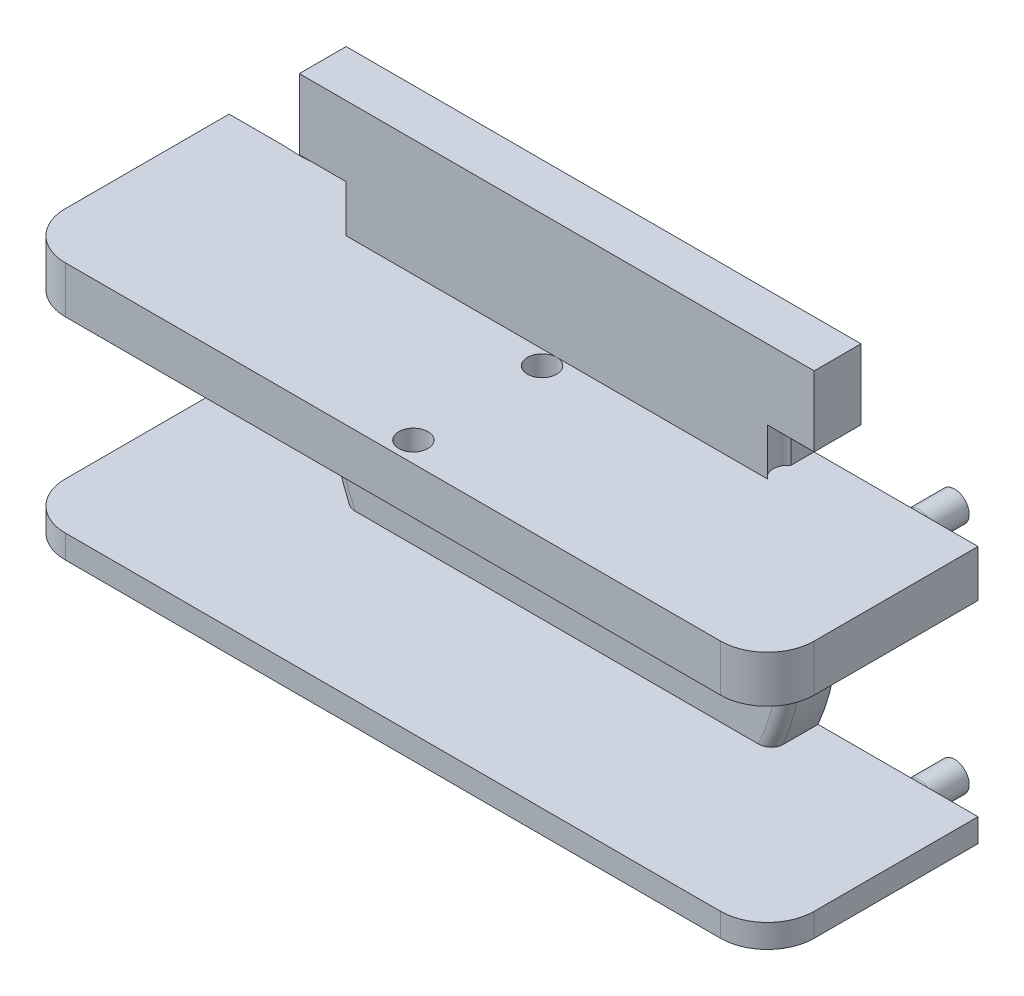
from build123d import *

# Parameters (mm, degrees)
BOSS_EXTRUDE1_DEPTH     = 2
SKETCH2_R               = 1.575
BOSS_EXTRUDE2_DEPTH     = 4
SKETCH3_R               = 3.5
BOSS_EXTRUDE3_DEPTH     = 1
SKETCH4_W               = 2
SKETCH4_H               = 17
BOSS_EXTRUDE4_DEPTH     = 0.001
SKETCH5_W               = 18
SKETCH5_H               = 2
BOSS_EXTRUDE5_DEPTH     = 0.001
SKETCH6_W               = 2.001
SKETCH6_H               = 2
BOSS_EXTRUDE6_DEPTH     = 5
BOSS_EXTRUDE7_DEPTH     = 0.001
CUT_EXTRUDE1_DEPTH      = 20.519323784
SKETCH9_W               = 2.937742252
SKETCH9_H               = 8
CUT_EXTRUDE2_DEPTH      = 0.001
CUT_EXTRUDE11_START     = -0.001
SKETCH21_R              = 9.75
SKETCH21_R_2            = 3.5
CUT_EXTRUDE11_DEPTH     = 0.001
SKETCH10_W              = 32
SKETCH10_H              = 2
BOSS_EXTRUDE8_DEPTH     = 7
FILLET1_R               = 0.5
SKETCH11_R              = 0.625
BOSS_EXTRUDE9_DEPTH     = 2
SKETCH14_W              = 2
SKETCH14_H              = 2
CUT_EXTRUDE5_DEPTH      = 22.401355237
SKETCH12_R              = 0.675
CUT_EXTRUDE3_DEPTH      = 2.5
CUT_EXTRUDE6_DEPTH      = 2
FILLET2_R               = 0.5
FILLET3_R               = 0.5
FILLET4_R               = 2
CUT_EXTRUDE7_DEPTH      = 26.019992106
CUT_EXTRUDE7_DEPTH_BACK = 1
SKETCH19_R              = 0.625
CUT_EXTRUDE9_DEPTH      = 2


with BuildPart() as part:
    # Sketch1 → Boss-Extrude1 (new body)
    with BuildSketch(Plane.XY):
        Polygon((-11, 6), (-11, 11), (11, 11), (11, 6), (11, -6), (-11, -6), align=None)
    extrude(amount=BOSS_EXTRUDE1_DEPTH)

    # Sketch3 → Boss-Extrude3 (add)
    with BuildSketch(Plane(origin=(0, 0, 0), x_dir=(-1, 0, 0), z_dir=(0, 0, -1))):
        with Locations(Location((0, 0, 0), (0, 0, 180))):
            Circle(SKETCH3_R)
    extrude(amount=BOSS_EXTRUDE3_DEPTH)

    # Sketch4 → Boss-Extrude4 (add)
    with BuildSketch(Plane(origin=(0, 0, 0), x_dir=(-1, 0, 0), z_dir=(0, 0, -1))):
        with Locations((10, 2.5)):
            Rectangle(SKETCH4_W, SKETCH4_H)
        with Locations((-10, 2.5)):
            Rectangle(SKETCH4_W, SKETCH4_H)
    extrude(amount=BOSS_EXTRUDE4_DEPTH)

    # Sketch5 → Boss-Extrude5 (add)
    with BuildSketch(Plane(origin=(0, 0, 0), x_dir=(-1, 0, 0), z_dir=(0, 0, -1))):
        with Locations((0, 10)):
            Rectangle(SKETCH5_W, SKETCH5_H)
    extrude(amount=BOSS_EXTRUDE5_DEPTH)

    # Sketch6 → Boss-Extrude6 (add)
    with BuildSketch(Plane(origin=(11, 0, 0), x_dir=(0, 0, -1), z_dir=(1, 0, 0))):
        with Locations((-0.9995, -5)):
            Rectangle(SKETCH6_W, SKETCH6_H)
        with Locations((-0.9995, 5)):
            Rectangle(SKETCH6_W, SKETCH6_H)
    boss_extrude6 = extrude(amount=BOSS_EXTRUDE6_DEPTH)

    # Mirror1: Boss-Extrude6 across plane
    add(boss_extrude6.mirror(Plane(origin=(0, 0, 0), x_dir=(0, 0, 1), z_dir=(1, 0, 0))))

    # Sketch7 → Boss-Extrude7 (add)
    with BuildSketch(Plane(origin=(0, 0, -0.001), x_dir=(-1, 0, 0), z_dir=(0, 0, -1))):
        with BuildLine():
            ThreePointArc((-6.708203932, -6), (-8.407551231, -3.211398808), (-9, 0))
            Line((-9, 0), (-9, -6))
            Line((-9, -6), (-6.708203932, -6))
        make_face()
        with BuildLine():
            Line((-9, 9), (-9, 0))
            ThreePointArc((-9, 0), (-6.363961031, 6.363961031), (0, 9))
            Line((0, 9), (-9, 9))
        make_face()
    boss_extrude7 = extrude(amount=-BOSS_EXTRUDE7_DEPTH)

    # Sketch8 → Cut-Extrude1 (cut, through all)
    with BuildSketch(Plane(origin=(0, 0, -0.001), x_dir=(-1, 0, 0), z_dir=(0, 0, -1))):
        with BuildLine():
            Line((-11, 4), (-9.16515139, 4))
            ThreePointArc((-9.16515139, 4), (-10, 0), (-9.16515139, -4))
            Line((-9.16515139, -4), (-11, -4))
            Line((-11, -4), (-11, 4))
        make_face()
    cut_extrude1 = extrude(amount=-CUT_EXTRUDE1_DEPTH, mode=Mode.SUBTRACT)

    # Sketch9 → Cut-Extrude2 (cut)
    with BuildSketch(Plane(origin=(0, 0, -0.001), x_dir=(-1, 0, 0), z_dir=(0, 0, -1))):
        with Locations((-9.531128874, 0)):
            Rectangle(SKETCH9_W, SKETCH9_H)
    cut_extrude2 = extrude(amount=-CUT_EXTRUDE2_DEPTH, mode=Mode.SUBTRACT)

    # Mirror2: Boss-Extrude7, Cut-Extrude1, Cut-Extrude2 across plane
    add(boss_extrude7.mirror(Plane(origin=(0, 0, 0), x_dir=(0, 0, 1), z_dir=(1, 0, 0))))
    add(cut_extrude1.mirror(Plane(origin=(0, 0, 0), x_dir=(0, 0, 1), z_dir=(1, 0, 0))), mode=Mode.SUBTRACT)
    add(cut_extrude2.mirror(Plane(origin=(0, 0, 0), x_dir=(0, 0, 1), z_dir=(1, 0, 0))), mode=Mode.SUBTRACT)

    # Sketch21 → Cut-Extrude11 (cut)
    with BuildSketch(Plane(origin=(0, 0, -0.001), x_dir=(-1, 0, 0), z_dir=(0, 0, -1)).offset(CUT_EXTRUDE11_START)):
        Circle(SKETCH21_R)
        with Locations(Location((0, 0, 0), (0, 0, 180))):
            Circle(SKETCH21_R_2, mode=Mode.SUBTRACT)
    extrude(amount=CUT_EXTRUDE11_DEPTH, mode=Mode.SUBTRACT)

    # Sketch10 → Boss-Extrude8 (add)
    with BuildSketch(Plane.XY.offset(2)):
        with Locations((0, -5)):
            Rectangle(SKETCH10_W, SKETCH10_H)
        with Locations((0, 5)):
            Rectangle(SKETCH10_W, SKETCH10_H)
    extrude(amount=BOSS_EXTRUDE8_DEPTH)

    # Fillet1
    fillet1_edges = [part.edges().sort_by_distance(p)[0] for p in [
        (10, 0, 2),
        (-10, 0, 2),
    ]]
    fillet(fillet1_edges, radius=FILLET1_R)

    # Sketch11 → Boss-Extrude9 (add)
    with BuildSketch(Plane(origin=(0, 0, -0.001), x_dir=(-1, 0, 0), z_dir=(0, 0, -1))):
        with Locations(Location((-13, -5, 0), (0, 0, 180))):
            Circle(SKETCH11_R)
    boss_extrude9 = extrude(amount=BOSS_EXTRUDE9_DEPTH)

    # Sketch14 → Cut-Extrude5 (cut, through all)
    with BuildSketch(Plane(origin=(0, 0, -0.001), x_dir=(-1, 0, 0), z_dir=(0, 0, -1))):
        with Locations((10, 7)):
            Rectangle(SKETCH14_W, SKETCH14_H)
        with Locations((-10, 7)):
            Rectangle(SKETCH14_W, SKETCH14_H)
    extrude(amount=-CUT_EXTRUDE5_DEPTH, mode=Mode.SUBTRACT)

    # Sketch12 → Cut-Extrude3 (cut)
    with BuildSketch(Plane(origin=(0, 0, -0.001), x_dir=(-1, 0, 0), z_dir=(0, 0, -1))):
        with Locations((13, -5)):
            Circle(SKETCH12_R)
    cut_extrude3 = extrude(amount=-CUT_EXTRUDE3_DEPTH, mode=Mode.SUBTRACT)

    # Sketch16 → Cut-Extrude6 (cut)
    with BuildSketch(Plane(origin=(0, 6, 0), x_dir=(1, 0, 0), z_dir=(0, 1, 0))):
        with BuildLine():
            Line((-9, -1), (-9, -2))
            ThreePointArc((-9, -2), (-8.75, -1.5), (-9, -1))
        make_face()
    cut_extrude6 = extrude(amount=CUT_EXTRUDE6_DEPTH, mode=Mode.SUBTRACT)

    # Mirror3: Boss-Extrude9, Cut-Extrude3 across plane
    add(boss_extrude9.mirror(Plane.ZX))
    add(cut_extrude3.mirror(Plane.ZX), mode=Mode.SUBTRACT)

    # Mirror4: Cut-Extrude6 across plane
    add(cut_extrude6.mirror(Plane(origin=(0, 0, 0), x_dir=(0, 0, 1), z_dir=(1, 0, 0))), mode=Mode.SUBTRACT)

    # Fillet2
    fillet2_edges = [part.edges().sort_by_distance(p)[0] for p in [
        (12.375, -5, -0.001),
        (12.375, 5, -0.001),
    ]]
    fillet(fillet2_edges, radius=FILLET2_R)

    # Fillet3
    # the kernel refuses this fillet: 0.5 mm, written as the material it takes off along each edge
    with BuildSketch(Plane(origin=(-13, -5, -0.001), x_dir=(-1, 0, 0), z_dir=(0, -1, 0))) as fillet3_piece_1:
        with BuildLine():
            CenterArc((0.675 + FILLET3_R, -FILLET3_R), FILLET3_R, 90, 90)
            Line((0.675, -FILLET3_R), (0.675, 0))
            Line((0.675, 0), (0.675 + FILLET3_R, 0))
        make_face()
    revolve(axis=Axis((-13, -5, -0.001), (0, 0, -1)), mode=Mode.SUBTRACT)
    with BuildSketch(Plane(origin=(-13, 5, -0.001), x_dir=(-1, 0, 0), z_dir=(0, 1, 0))) as fillet3_piece_2:
        with BuildLine():
            CenterArc((0.675 + FILLET3_R, FILLET3_R), FILLET3_R, 180, 90)
            Line((0.675, FILLET3_R), (0.675, 0))
            Line((0.675, 0), (0.675 + FILLET3_R, 0))
        make_face()
    revolve(axis=Axis((-13, 5, -0.001), (0, 0, 1)), mode=Mode.SUBTRACT)

    # Fillet4
    fillet4_edges = [part.edges().sort_by_distance(p)[0] for p in [
        (16, -5, 9),
        (-16, -5, 9),
        (-16, 5, 9),
        (16, 5, 9),
    ]]
    fillet(fillet4_edges, radius=FILLET4_R)

    # Sketch17 → Cut-Extrude7 (cut, two sides: drawn at the far end of the back side and taken through both)
    with BuildSketch(Plane.XZ.offset(6).offset(-CUT_EXTRUDE7_DEPTH_BACK)):
        with BuildLine():
            Line((-16, 7), (-16, -0.001))
            Line((-16, -0.001), (-14.5, -0.001))
            Line((-14.5, -0.001), (-14.5, 7))
            ThreePointArc((-14.5, 7), (-14.353553391, 7.353553391), (-14, 7.5))
            Line((-14, 7.5), (14, 7.5))
            ThreePointArc((14, 7.5), (14.353553391, 7.353553391), (14.5, 7))
            Line((14.5, 7), (14.5, -0.001))
            Line((14.5, -0.001), (16, -0.001))
            Line((16, -0.001), (16, 7))
            ThreePointArc((16, 7), (15.414213562, 8.414213562), (14, 9))
            Line((14, 9), (-14, 9))
            ThreePointArc((-14, 9), (-15.414213562, 8.414213562), (-16, 7))
        make_face()
    extrude(amount=CUT_EXTRUDE7_DEPTH + CUT_EXTRUDE7_DEPTH_BACK, mode=Mode.SUBTRACT)

    # Sketch19 → Cut-Extrude9 (cut)
    with BuildSketch(Plane(origin=(0, 6, 0), x_dir=(1, 0, 0), z_dir=(0, 1, 0))):
        with Locations(Location((0, -2.625, 0), (0, 0, 90))):
            Circle(SKETCH19_R)
        with Locations(Location((0, -8.125, 0), (0, 0, 270))):
            Circle(SKETCH19_R)
    extrude(amount=-CUT_EXTRUDE9_DEPTH, mode=Mode.SUBTRACT)


with BuildPart() as body_2:
    # Sketch2 → Boss-Extrude2 (new body)
    with BuildSketch(Plane(origin=(0, 0, 2), x_dir=(-1, 0, 0), z_dir=(0, 0, -1))):
        Circle(SKETCH2_R)
    extrude(amount=BOSS_EXTRUDE2_DEPTH)


with BuildPart() as part_1:
    add(part.part)

    # Combine2: cut body 2
    add(body_2.part, mode=Mode.SUBTRACT)


solid = part_1.part
